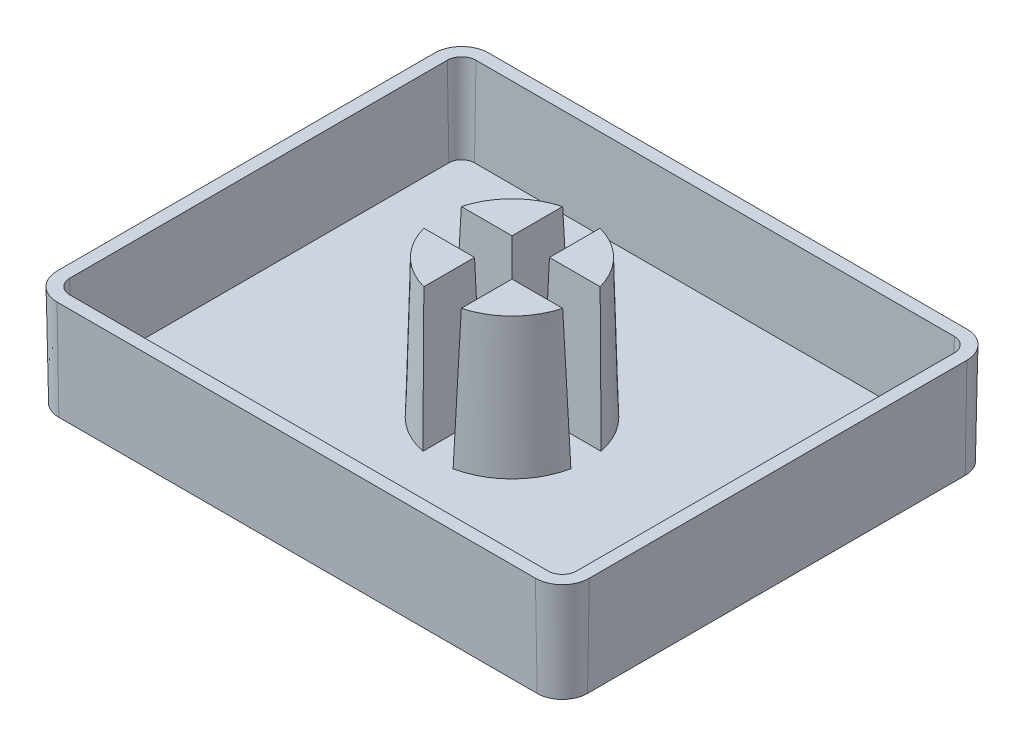
from build123d import *

# Parameters (mm, degrees)
BOSS_EXTRUDE1_DEPTH           = 4
BOSS_EXTRUDE1_DRAFT           = -1
SHELL1_T                      = -0.5
BOSS_EXTRUDE2_DEPTH           = 5.5
BOSS_EXTRUDE2_DRAFT           = 1.5
BOSS_EXTRUDE2_PROFILE_2_DEPTH = 5.5
BOSS_EXTRUDE2_PROFILE_2_DRAFT = 1.5
BOSS_EXTRUDE2_PROFILE_3_DEPTH = 5.5
BOSS_EXTRUDE2_PROFILE_3_DRAFT = 1.5
BOSS_EXTRUDE2_PROFILE_4_DEPTH = 5.5
BOSS_EXTRUDE2_PROFILE_4_DRAFT = 1.5


with BuildPart() as part:
    # Sketch1 → Boss-Extrude1 (with draft: the straight prism first)
    with BuildSketch(Plane(origin=(0, 0, 0), x_dir=(1, 0, 0), z_dir=(0, 1, 0))):
        with BuildLine():
            Line((-9.5, -8.5), (9.5, -8.5))
            ThreePointArc((9.5, -8.5), (10.207106781, -8.207106781), (10.5, -7.5))
            Line((10.5, -7.5), (10.5, 7.5))
            ThreePointArc((10.5, 7.5), (10.207106781, 8.207106781), (9.5, 8.5))
            Line((9.5, 8.5), (-9.5, 8.5))
            ThreePointArc((-9.5, 8.5), (-10.207106781, 8.207106781), (-10.5, 7.5))
            Line((-10.5, 7.5), (-10.5, -7.5))
            ThreePointArc((-10.5, -7.5), (-10.207106781, -8.207106781), (-9.5, -8.5))
        make_face()
    extrude(amount=BOSS_EXTRUDE1_DEPTH)
    # Boss-Extrude1: the draft: its side faces are tilted about the plane it starts from
    boss_extrude1_sides = [part.faces().sort_by_distance(p)[0] for p in [
        (0, 2, 8.5),
        (10.207106781, 2, 8.207106781),
        (10.5, 2, 0),
        (10.207106781, 2, -8.207106781),
        (0, 2, -8.5),
        (-10.207106781, 2, -8.207106781),
        (-10.5, 2, 0),
        (-10.207106781, 2, 8.207106781),
    ]]
    draft(boss_extrude1_sides, Plane(origin=(0, 0, 0), x_dir=(1, 0, 0), z_dir=(0, 1, 0)), BOSS_EXTRUDE1_DRAFT)

    # Shell1
    shell1_openings = [part.faces().sort_by_distance(p)[0] for p in [
        (0, 4, 0),
    ]]
    offset(amount=SHELL1_T, openings=shell1_openings, kind=Kind.INTERSECTION)


with BuildPart() as boss_extrude2_tool:
    # Sketch2 → Boss-Extrude2 (with draft: the straight prism first)
    with BuildSketch(Plane(origin=(0, 0.5, 0), x_dir=(1, 0, 0), z_dir=(0, 1, 0))):
        with BuildLine():
            ThreePointArc((-0.6, 2.939387691), (-2.121320344, 2.121320344), (-2.939387691, 0.6))
            Line((-2.939387691, 0.6), (-0.6, 0.6))
            Line((-0.6, 0.6), (-0.6, 2.939387691))
        make_face()
    extrude(amount=BOSS_EXTRUDE2_DEPTH)
    # Boss-Extrude2: the draft: its side faces are tilted about the plane it starts from
    boss_extrude2_sides = [boss_extrude2_tool.faces().sort_by_distance(p)[0] for p in [
        (-2.121320344, 3.25, -2.121320344),
        (-1.769693846, 3.25, -0.6),
        (-0.6, 3.25, -1.769693846),
    ]]
    draft(boss_extrude2_sides, Plane(origin=(0, 0.5, 0), x_dir=(1, 0, 0), z_dir=(0, 1, 0)), BOSS_EXTRUDE2_DRAFT)


with BuildPart() as part_1:
    add(part.part)

    # Boss-Extrude2: add boss_extrude2_tool
    add(boss_extrude2_tool.part)


with BuildPart() as boss_extrude2_profile_2_tool:
    # Sketch2 → Boss-Extrude2 profile 2 (with draft: the straight prism first)
    with BuildSketch(Plane(origin=(0, 0.5, 0), x_dir=(1, 0, 0), z_dir=(0, 1, 0))):
        with BuildLine():
            ThreePointArc((-2.939387691, -0.6), (-2.121320344, -2.121320344), (-0.6, -2.939387691))
            Line((-0.6, -2.939387691), (-0.6, -0.6))
            Line((-0.6, -0.6), (-2.939387691, -0.6))
        make_face()
    extrude(amount=BOSS_EXTRUDE2_PROFILE_2_DEPTH)
    # Boss-Extrude2 profile 2: the draft: its side faces are tilted about the plane it starts from
    boss_extrude2_profile_2_sides = [boss_extrude2_profile_2_tool.faces().sort_by_distance(p)[0] for p in [
        (-2.121320344, 3.25, 2.121320344),
        (-0.6, 3.25, 1.769693846),
        (-1.769693846, 3.25, 0.6),
    ]]
    draft(boss_extrude2_profile_2_sides, Plane(origin=(0, 0.5, 0), x_dir=(1, 0, 0), z_dir=(0, 1, 0)), BOSS_EXTRUDE2_PROFILE_2_DRAFT)


with BuildPart() as part_2:
    add(part_1.part)

    # Boss-Extrude2 profile 2: add boss_extrude2_profile_2_tool
    add(boss_extrude2_profile_2_tool.part)


with BuildPart() as boss_extrude2_profile_3_tool:
    # Sketch2 → Boss-Extrude2 profile 3 (with draft: the straight prism first)
    with BuildSketch(Plane(origin=(0, 0.5, 0), x_dir=(1, 0, 0), z_dir=(0, 1, 0))):
        with BuildLine():
            Line((0.6, 2.939387691), (0.6, 0.6))
            Line((0.6, 0.6), (2.939387691, 0.6))
            ThreePointArc((2.939387691, 0.6), (2.121320344, 2.121320344), (0.6, 2.939387691))
        make_face()
    extrude(amount=BOSS_EXTRUDE2_PROFILE_3_DEPTH)
    # Boss-Extrude2 profile 3: the draft: its side faces are tilted about the plane it starts from
    boss_extrude2_profile_3_sides = [boss_extrude2_profile_3_tool.faces().sort_by_distance(p)[0] for p in [
        (0.6, 3.25, -1.769693846),
        (1.769693846, 3.25, -0.6),
        (2.121320344, 3.25, -2.121320344),
    ]]
    draft(boss_extrude2_profile_3_sides, Plane(origin=(0, 0.5, 0), x_dir=(1, 0, 0), z_dir=(0, 1, 0)), BOSS_EXTRUDE2_PROFILE_3_DRAFT)


with BuildPart() as part_3:
    add(part_2.part)

    # Boss-Extrude2 profile 3: add boss_extrude2_profile_3_tool
    add(boss_extrude2_profile_3_tool.part)


with BuildPart() as boss_extrude2_profile_4_tool:
    # Sketch2 → Boss-Extrude2 profile 4 (with draft: the straight prism first)
    with BuildSketch(Plane(origin=(0, 0.5, 0), x_dir=(1, 0, 0), z_dir=(0, 1, 0))):
        with BuildLine():
            Line((0.6, -0.6), (0.6, -2.939387691))
            ThreePointArc((0.6, -2.939387691), (2.121320344, -2.121320344), (2.939387691, -0.6))
            Line((2.939387691, -0.6), (0.6, -0.6))
        make_face()
    extrude(amount=BOSS_EXTRUDE2_PROFILE_4_DEPTH)
    # Boss-Extrude2 profile 4: the draft: its side faces are tilted about the plane it starts from
    boss_extrude2_profile_4_sides = [boss_extrude2_profile_4_tool.faces().sort_by_distance(p)[0] for p in [
        (1.769693846, 3.25, 0.6),
        (0.6, 3.25, 1.769693846),
        (2.121320344, 3.25, 2.121320344),
    ]]
    draft(boss_extrude2_profile_4_sides, Plane(origin=(0, 0.5, 0), x_dir=(1, 0, 0), z_dir=(0, 1, 0)), BOSS_EXTRUDE2_PROFILE_4_DRAFT)


with BuildPart() as part_4:
    add(part_3.part)

    # Boss-Extrude2 profile 4: add boss_extrude2_profile_4_tool
    add(boss_extrude2_profile_4_tool.part)


solid = part_4.part
